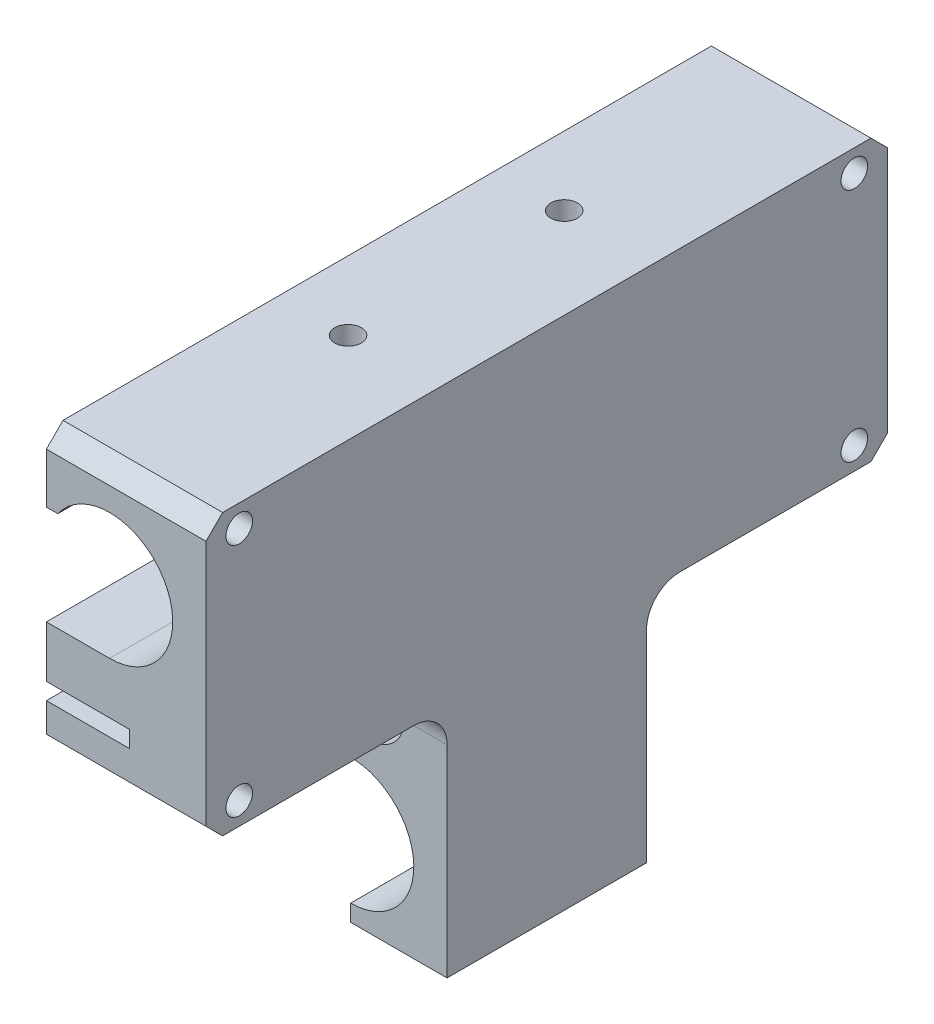
from build123d import *

# Parameters (mm, degrees)
BOSS_EXTRUDE1_DEPTH      = 82
BOSS_EXTRUDE2_DEPTH      = 17
BOSS_EXTRUDE2_DEPTH_BACK = 17
CUT_EXTRUDE1_DEPTH       = 10
SKETCH6_R                = 1.6
CUT_EXTRUDE2_DEPTH       = 98.738426425
CUT_EXTRUDE3_DEPTH       = 14
CHAMFER1_SIZE            = 2
SKETCH9_W                = 29
SKETCH9_H                = 28.3
CUT_EXTRUDE4_DEPTH       = 98.738426425
FILLET1_R                = 4
FILLET2_R                = 4
CHAMFER2_SIZE            = 2
CHAMFER3_SIZE            = 5
FILLET3_R                = 4
CUT_EXTRUDE5_REACH       = 109.79
CUT_EXTRUDE5_START       = -10.003729205
SKETCH11_R               = 1.6
CUT_EXTRUDE6_DEPTH       = 5


with BuildPart() as part:
    # Sketch1 → Boss-Extrude1 (new body)
    with BuildSketch(Plane.XY):
        with BuildLine():
            Line((0, -47.6), (0, -49.6))
            Line((0, -49.6), (11.6, -49.6))
            Line((11.6, -49.6), (11.6, 12.4))
            Line((11.6, 12.4), (-7.6, 12.4))
            Line((-7.6, 12.4), (-7.6, 4.359180916))
            Line((-7.6, 4.359180916), (-6.225555537, 4.359180916))
            ThreePointArc((-6.225555537, 4.359180916), (6.741282332, 3.509289461), (0, -7.6))
            Line((0, -7.6), (-7.6, -7.6))
            Line((-7.6, -7.6), (-7.6, -9.6))
            Line((-7.6, -9.6), (-7.6, -18.625988463))
            Line((-7.6, -18.625988463), (-7.6, -36.851976926))
            Line((-7.6, -36.851976926), (-5.374011537, -34.625988463))
            ThreePointArc((-5.374011537, -34.625988463), (7.021484447, -37.091605914), (0, -47.6))
        make_face()
    extrude(amount=BOSS_EXTRUDE1_DEPTH)

    # Sketch2 → Boss-Extrude2 (add, two sides: drawn at the far end of the back side and taken through both)
    with BuildSketch(Plane(origin=(0, 0, 41), x_dir=(-1, 0, 0), z_dir=(0, 0, -1)).offset(-BOSS_EXTRUDE2_DEPTH_BACK)):
        with BuildLine():
            Line((0, -7.6), (7.6, -7.6))
            Line((7.6, -7.6), (7.6, -5))
            Line((7.6, -5), (0, -5))
            ThreePointArc((0, -5), (-4.837142988, 1.265720233), (2.448987901, 4.359180916))
            Line((2.448987901, 4.359180916), (6.225555537, 4.359180916))
            ThreePointArc((6.225555537, 4.359180916), (-6.741282332, 3.509289461), (0, -7.6))
        make_face()
    extrude(amount=BOSS_EXTRUDE2_DEPTH + BOSS_EXTRUDE2_DEPTH_BACK)

    # Sketch4 → Cut-Extrude1 (cut)
    with BuildSketch(Plane.ZY.offset(7.6)):
        Polygon((82, -13.8), (54.66, -13.8), (54.66, -15), (27.33, -15), (27.33, -13.8), (0, -13.8), (0, -15.8), (82, -15.8), align=None)
    extrude(amount=-CUT_EXTRUDE1_DEPTH, mode=Mode.SUBTRACT)

    # Sketch6 → Cut-Extrude2 (cut, through all)
    with BuildSketch(Plane.ZY.offset(7.6)):
        with Locations((4, 9.74)):
            Circle(SKETCH6_R)
        with Locations((4, -18.6)):
            Circle(SKETCH6_R)
    cut_extrude2 = extrude(amount=-CUT_EXTRUDE2_DEPTH, mode=Mode.SUBTRACT)

    # Mirror1: Cut-Extrude2 across plane
    add(cut_extrude2.mirror(Plane(origin=(0, 0, 41), x_dir=(1, 0, 0), z_dir=(0, 0, -1))), mode=Mode.SUBTRACT)

    # Sketch7 → Cut-Extrude3 (cut)
    with BuildSketch(Plane.ZY.offset(7.6)):
        Polygon((0, -29.4), (82, -29.4), (82, -21.3), (74, -21.3), (8, -21.3), (0, -21.3), align=None)
    extrude(amount=-CUT_EXTRUDE3_DEPTH, mode=Mode.SUBTRACT)

    # Chamfer1
    chamfer1_edges = [part.edges().sort_by_distance(p)[0] for p in [
        (2, 12.4, 82),
        (2, 12.4, 0),
    ]]
    chamfer(chamfer1_edges, length=CHAMFER1_SIZE)

    # Sketch9 → Cut-Extrude4 (cut, through all)
    with BuildSketch(Plane.ZY.offset(7.6)):
        with Locations((67.5, -35.45)):
            Rectangle(SKETCH9_W, SKETCH9_H)
        with Locations((14.5, -35.45)):
            Rectangle(SKETCH9_W, SKETCH9_H)
    extrude(amount=-CUT_EXTRUDE4_DEPTH, mode=Mode.SUBTRACT)

    # Fillet1
    fillet1_edges = [part.edges().sort_by_distance(p)[0] for p in [
        (6.4, -29.4, 41),
        (6.4, -21.3, 41),
    ]]
    fillet(fillet1_edges, radius=FILLET1_R)

    # Fillet2
    fillet2_edges = [part.edges().sort_by_distance(p)[0] for p in [
        (7, -21.3, 53),
        (7, -21.3, 29),
    ]]
    fillet(fillet2_edges, radius=FILLET2_R)

    # Chamfer2
    chamfer2_edges = [part.edges().sort_by_distance(p)[0] for p in [
        (2, -21.3, 82),
        (2, -21.3, 0),
    ]]
    chamfer(chamfer2_edges, length=CHAMFER2_SIZE)

    # Chamfer3
    chamfer3_edges = [part.edges().sort_by_distance(p)[0] for p in [
        (-7.6, -29.4, 41),
    ]]
    chamfer(chamfer3_edges, length=CHAMFER3_SIZE)

    # Fillet3
    fillet3_edges = [part.edges().sort_by_distance(p)[0] for p in [
        (-7.6, -34.4, 41),
        (-2.6, -29.4, 41),
    ]]
    fillet(fillet3_edges, radius=FILLET3_R)

    # Sketch11 → Cut-Extrude5 (cut, up to next)
    with BuildSketch(Plane.XZ.offset(-2.396270795).offset(CUT_EXTRUDE5_START), mode=Mode.PRIVATE) as cut_extrude5_sk1:
        with Locations((0.687222232, 54)):
            Circle(SKETCH11_R)
    cut_extrude5_tool1 = extrude(cut_extrude5_sk1.sketch, amount=CUT_EXTRUDE5_REACH, mode=Mode.PRIVATE) & part.part
    cut_extrude5 = cut_extrude5_tool1.solids().sort_by_distance((0.687222, 12.4, 54))[0]
    add(cut_extrude5, mode=Mode.SUBTRACT)

    # Mirror2: Cut-Extrude5 across plane
    add(cut_extrude5.mirror(Plane(origin=(0, 0, 41), x_dir=(1, 0, 0), z_dir=(0, 0, -1))), mode=Mode.SUBTRACT)

    # Sketch12 → Cut-Extrude6 (cut)
    with BuildSketch(Plane.XZ.offset(-2.396270795)):
        Polygon((-2.08405906, 52.4), (0.687222232, 50.8), (3.458503524, 52.4), (3.458503524, 55.6), (0.687222232, 57.2), (-2.08405906, 55.6), align=None)
    cut_extrude6 = extrude(amount=-CUT_EXTRUDE6_DEPTH, mode=Mode.SUBTRACT)

    # Mirror3: Cut-Extrude6 across plane
    add(cut_extrude6.mirror(Plane(origin=(0, 0, 41), x_dir=(1, 0, 0), z_dir=(0, 0, -1))), mode=Mode.SUBTRACT)


solid = part.part
